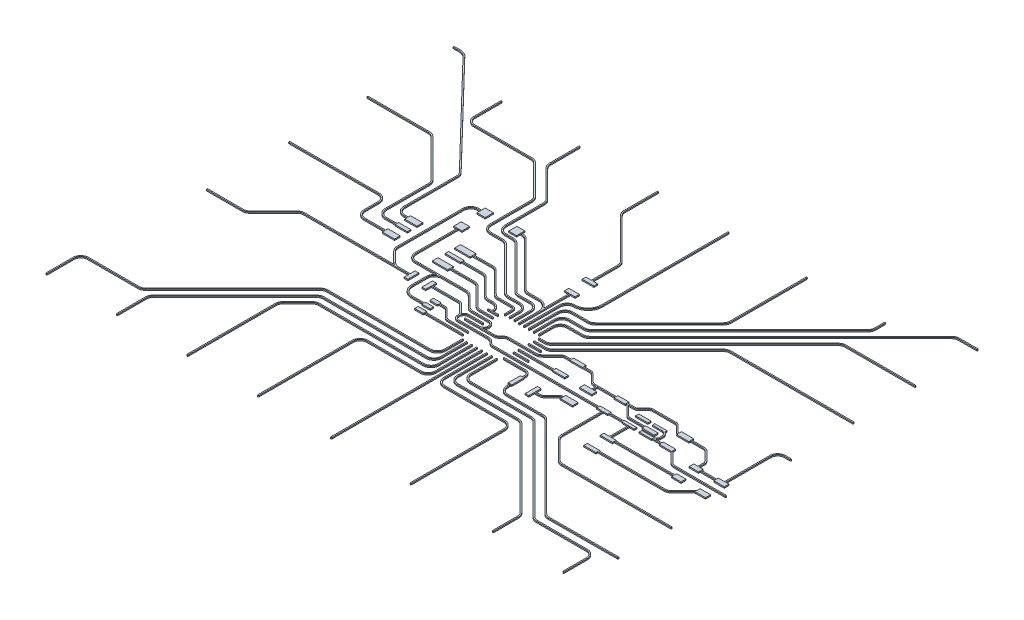
from build123d import *

# Parameters (mm, degrees)
BOSS_EXTRUDE1_DEPTH      = 0.2
BOSS_EXTRUDE2_DEPTH      = 0.01
BOSS_EXTRUDE2_DEPTH_BACK = 0.2
SKETCH5_W                = 2
SKETCH5_H                = 0.6
SKETCH5_H_2              = 0.801074898
SKETCH5_H_3              = 0.899691602
SKETCH5_W_2              = 0.6
SKETCH5_H_4              = 2
SKETCH5_H_5              = 0.63071227
SKETCH5_H_6              = 0.392724087
SKETCH5_H_7              = 0.44743684
SKETCH5_H_8              = 0.517672069
SKETCH5_H_9              = 0.795803545
SKETCH5_W_3              = 1.785055918
SKETCH5_H_10             = 0.617750025
SKETCH5_H_11             = 0.54655368
SKETCH5_H_12             = 0.660803526
SKETCH5_W_4              = 1.511774088
SKETCH5_H_13             = 0.749910678
SKETCH5_H_14             = 0.8
SKETCH5_W_5              = 1.702823586
SKETCH5_H_15             = 0.837747473
SKETCH5_W_6              = 1.25945291
SKETCH5_H_16             = 0.586172495
SKETCH5_W_7              = 1.315002125
SKETCH5_H_17             = 0.583888388
SKETCH5_W_8              = 1.380016589
SKETCH5_H_18             = 0.587615138
SKETCH5_W_9              = 0.603522402
SKETCH5_H_19             = 1.765265078
SKETCH5_W_10             = 0.63772589
SKETCH5_H_20             = 1.734095161
SKETCH5_W_11             = 1.900035091
SKETCH5_H_21             = 0.614152085
SKETCH5_W_12             = 1.726854463
SKETCH5_H_22             = 0.705413503
SKETCH5_W_13             = 2.503904973
SKETCH5_H_23             = 0.95039046
SKETCH5_H_24             = 0.571234979
SKETCH5_H_25             = 0.912283783
SKETCH5_W_14             = 1.994845849
SKETCH5_W_15             = 1.345745511
SKETCH5_H_26             = 1.337318337
SKETCH5_W_16             = 1.283826235
SKETCH5_H_27             = 1.227661167


# Read off the part's stored shape, not the designer's step: Boss-Extrude1
with BuildPart() as part:
    # Boss-Extrude1 outline → Boss-Extrude1 (new body)
    with BuildSketch(Plane(origin=(0, 10, 0), x_dir=(1, 0, 0), z_dir=(0, 1, 0))):
        with BuildLine():
            ThreePointArc((-7.271038605, -7.663864198), (-7.371009258, -7.763893536), (-7.27097992, -7.863864189))
            Line((-7.27097992, -7.863864189), (-0.45497992, -7.861864189))
            ThreePointArc((-0.45497992, -7.861864189), (-0.355009267, -7.761834851), (-0.455038605, -7.661864198))
            Line((-0.455038605, -7.661864198), (-7.271038605, -7.663864198))
        make_face()
        with BuildLine():
            Line((17.890290737, -5.558664194), (17.890290737, -4.255664194))
            Line((17.890290737, -4.255664194), (22.634495322, -4.255664194))
            Line((22.634495322, -4.255664194), (24.219983941, -5.840978753))
            ThreePointArc((24.219983941, -5.840978753), (24.511973795, -6.036062062), (24.856390737, -6.104564194))
            Line((24.856390737, -6.104564194), (28.491390737, -6.104564194))
            ThreePointArc((28.491390737, -6.104564194), (28.591390737, -6.004564194), (28.491390737, -5.904564194))
            Line((28.491390737, -5.904564194), (24.856390737, -5.904564194))
            ThreePointArc((24.856390737, -5.904564194), (24.58850541, -5.851284055), (24.361397534, -5.699549634))
            Line((24.361397534, -5.699549634), (22.917353562, -4.255664194))
            Line((22.917353562, -4.255664194), (23.811696874, -4.255664194))
            ThreePointArc((23.811696874, -4.255664194), (24.079598697, -4.20234617), (24.306706729, -4.050569558))
            Line((24.306706729, -4.050569558), (25.177001415, -3.180274872))
            ThreePointArc((25.177001415, -3.180274872), (25.339185941, -3.071915363), (25.530491226, -3.033864193))
            Line((25.530491226, -3.033864193), (29.233490737, -3.033864193))
            ThreePointArc((29.233490737, -3.033864193), (29.424797731, -3.071916273), (29.586983078, -3.18027789))
            Line((29.586983078, -3.18027789), (30.462284515, -4.055579327))
            ThreePointArc((30.462284515, -4.055579327), (30.689405563, -4.207301488), (30.95729858, -4.260564193))
            Line((30.95729858, -4.260564193), (35.056583559, -4.260564193))
            ThreePointArc((35.056583559, -4.260564193), (35.324478774, -4.313891335), (35.551577941, -4.465672754))
            Line((35.551577941, -4.465672754), (36.936982611, -5.850977423))
            ThreePointArc((36.936982611, -5.850977423), (37.0887122, -6.078082731), (37.141990737, -6.345963462))
            Line((37.141990737, -6.345963462), (37.141990737, -7.617564193))
            ThreePointArc((37.141990737, -7.617564193), (37.178100423, -7.694492913), (37.260351294, -7.715864194))
            Line((37.260351294, -7.715864194), (41.668790737, -7.715864194))
            Line((41.668790737, -7.715864194), (41.668790737, 0.080635806))
            ThreePointArc((41.668790737, 0.080635806), (41.990982234, 0.858445947), (42.768793053, 1.180635806))
            Line((42.768793053, 1.180635806), (43.657490737, 1.180635806))
            ThreePointArc((43.657490737, 1.180635806), (43.757490737, 1.280635806), (43.657490737, 1.380635806))
            Line((43.657490737, 1.380635806), (42.768788422, 1.380635806))
            ThreePointArc((42.768788422, 1.380635806), (41.849559241, 0.999865666), (41.468790737, 0.080635806))
            Line((41.468790737, 0.080635806), (41.468790737, -7.515864194))
            Line((41.468790737, -7.515864194), (37.341990738, -7.515864194))
            Line((37.341990738, -7.515864194), (37.341990738, -6.345964924))
            ThreePointArc((37.341990738, -6.345964924), (37.273487005, -6.001543386), (37.078398864, -5.709550964))
            Line((37.078398864, -5.709550964), (35.693003533, -4.324255634))
            ThreePointArc((35.693003533, -4.324255634), (35.40102486, -4.129119322), (35.056597916, -4.060564194))
            Line((35.056597916, -4.060564194), (30.957282894, -4.060564194))
            ThreePointArc((30.957282894, -4.060564194), (30.765929181, -4.02252017), (30.60369696, -3.91414906))
            Line((30.60369696, -3.91414906), (29.728398397, -3.038850497))
            ThreePointArc((29.728398397, -3.038850497), (29.501330474, -2.887138734), (29.233490738, -2.833864194))
            Line((29.233490738, -2.833864194), (25.530490248, -2.833864194))
            ThreePointArc((25.530490248, -2.833864194), (25.262648803, -2.887139644), (25.035580059, -3.038853516))
            Line((25.035580059, -3.038853516), (24.165274746, -3.909158829))
            ThreePointArc((24.165274746, -3.909158829), (24.003049399, -4.017575488), (23.811684601, -4.055664194))
            Line((23.811684601, -4.055664194), (17.276097949, -4.055660371))
            ThreePointArc((17.276097949, -4.055660371), (17.00820135, -4.002332656), (16.781101449, -3.850549693))
            Line((16.781101449, -3.850549693), (15.668308236, -2.73775648))
            ThreePointArc((15.668308236, -2.73775648), (15.376327944, -2.542616763), (15.03189795, -2.47406037))
            Line((15.03189795, -2.47406037), (10.985583593, -2.47406037))
            ThreePointArc((10.985583593, -2.47406037), (10.641158032, -2.542614926), (10.349180093, -2.737749692))
            Line((10.349180093, -2.737749692), (8.937281891, -4.149647894))
            ThreePointArc((8.937281891, -4.149647894), (8.580380277, -4.3881152), (8.159390771, -4.47186037))
            Line((8.159390771, -4.47186037), (7.244590771, -4.46386037))
            Line((7.244590771, -4.46386037), (3.805990737, -4.463864194))
            ThreePointArc((3.805990737, -4.463864194), (3.385049161, -4.547602796), (3.028188742, -4.786044833))
            Line((3.028188742, -4.786044833), (2.813888742, -5.000244833))
            ThreePointArc((2.813888742, -5.000244833), (2.521905337, -5.195345662), (2.1774872, -5.263864194))
            Line((2.1774872, -5.263864194), (0.32952187, -5.263864194))
            ThreePointArc((0.32952187, -5.263864194), (0.372451605, -5.226865441), (0.412970213, -5.187240799))
            ThreePointArc((0.412970213, -5.187240799), (0.591745853, -4.211047066), (-0.236206947, -3.663864193))
            Line((-0.236206947, -3.663864193), (-2.927409263, -3.663864193))
            ThreePointArc((-2.927409263, -3.663864193), (-3.34839877, -3.580119024), (-3.705300383, -3.341651717))
            Line((-3.705300383, -3.341651717), (-5.400298584, -1.646653515))
            ThreePointArc((-5.400298584, -1.646653515), (-5.822083221, -1.364833394), (-6.319607047, -1.265864194))
            Line((-6.319607047, -1.265864194), (-14.494109263, -1.265864194))
            ThreePointArc((-14.494109263, -1.265864194), (-15.271919403, -0.943672697), (-15.594109263, -0.165861878))
            Line((-15.594109263, -0.165861878), (-15.594109263, 7.296235806))
            ThreePointArc((-15.594109263, 7.296235806), (-15.694109263, 7.396235806), (-15.794109263, 7.296235806))
            Line((-15.794109263, 7.296235806), (-15.794109263, -0.165866509))
            ThreePointArc((-15.794109263, -0.165866509), (-15.413339122, -1.08509569), (-14.494109263, -1.465864194))
            Line((-14.494109263, -1.465864194), (-10.916538048, -1.465864194))
            ThreePointArc((-10.916538048, -1.465864194), (-11.384941112, -1.954973986), (-11.555509263, -2.610364194))
            Line((-11.555509263, -2.610364194), (-11.555509263, -4.973066509))
            ThreePointArc((-11.555509263, -4.973066509), (-11.057579122, -6.17513569), (-9.855509263, -6.673064194))
            Line((-9.855509263, -6.673064194), (-7.327209263, -6.673064194))
            ThreePointArc((-7.327209263, -6.673064194), (-7.227209263, -6.573064194), (-7.327209263, -6.473064194))
            Line((-7.327209263, -6.473064194), (-9.855509263, -6.473064194))
            ThreePointArc((-9.855509263, -6.473064194), (-10.916159403, -6.033712697), (-11.355509263, -4.973061878))
            Line((-11.355509263, -4.973061878), (-11.355509263, -2.610364194))
            ThreePointArc((-11.355509263, -2.610364194), (-11.020284535, -1.801088922), (-10.211009263, -1.465864194))
            Line((-10.211009263, -1.465864194), (-6.319611478, -1.465864194))
            ThreePointArc((-6.319611478, -1.465864194), (-5.898621954, -1.549608453), (-5.541719941, -1.788074872))
            Line((-5.541719941, -1.788074872), (-3.846718142, -3.48307667))
            ThreePointArc((-3.846718142, -3.48307667), (-3.424933106, -3.764895904), (-2.927409263, -3.863864194))
            Line((-2.927409263, -3.863864194), (-0.236211578, -3.863864194))
            ThreePointArc((-0.236211578, -3.863864194), (0.256651333, -4.066795091), (0.463765298, -4.557914836))
            ThreePointArc((0.463765298, -4.557914836), (0.283422603, -5.062163707), (-0.21266945, -5.263864194))
            Line((-0.21266945, -5.263864194), (-2.459009263, -5.263864194))
            ThreePointArc((-2.459009263, -5.263864194), (-2.559009263, -5.363864194), (-2.459009263, -5.463864194))
            Line((-2.459009263, -5.463864194), (2.177494274, -5.463864194))
            ThreePointArc((2.177494274, -5.463864194), (2.598433947, -5.380124915), (2.955292732, -5.141683555))
            Line((2.955292732, -5.141683555), (3.169592732, -4.927483555))
            ThreePointArc((3.169592732, -4.927483555), (3.461574503, -4.732383401), (3.805990737, -4.663864194))
            Line((3.805990737, -4.663864194), (7.244590737, -4.663864194))
            Line((7.244590737, -4.663864194), (8.159390737, -4.671864194))
            ThreePointArc((8.159390737, -4.671864194), (8.65691458, -4.572895903), (9.078699617, -4.29107667))
            Line((9.078699617, -4.29107667), (10.490601415, -2.879174872))
            ThreePointArc((10.490601415, -2.879174872), (10.717701316, -2.727391908), (10.985597916, -2.674064193))
            Line((10.985597916, -2.674064193), (15.031883558, -2.674064193))
            ThreePointArc((15.031883558, -2.674064193), (15.299775724, -2.727390071), (15.526873272, -2.879168084))
            Line((15.526873272, -2.879168084), (16.639680059, -3.991974871))
            ThreePointArc((16.639680059, -3.991974871), (16.931657558, -4.187111695), (17.276083559, -4.255668016))
            Line((17.276083559, -4.255668016), (17.690290737, -4.255668016))
            Line((17.690290737, -4.255668016), (17.690290737, -5.558664194))
            ThreePointArc((17.690290737, -5.558664194), (17.790290737, -5.658664194), (17.890290737, -5.558664194))
        make_face()
        with BuildLine():
            Line((21.839490737, -13.824261978), (21.839490737, -7.054664194))
            Line((21.839490737, -7.054664194), (25.787490737, -7.054664194))
            Line((25.787490737, -7.054664194), (25.787490737, -10.411064194))
            ThreePointArc((25.787490737, -10.411064194), (25.796006873, -10.451446151), (25.820104787, -10.484950144))
            ThreePointArc((25.820104787, -10.484950144), (25.85360878, -10.509048058), (25.893990737, -10.517564194))
            Line((25.893990737, -10.517564194), (37.241990737, -10.517564194))
            ThreePointArc((37.241990737, -10.517564194), (37.341990737, -10.417564194), (37.241990737, -10.317564194))
            Line((37.241990737, -10.317564194), (25.987490737, -10.317564194))
            Line((25.987490737, -10.317564194), (25.987490737, -6.981614333))
            ThreePointArc((25.987490737, -6.981614333), (25.97086198, -6.894228335), (25.891190737, -6.854664194))
            Line((25.891190737, -6.854664194), (21.740490737, -6.854664194))
            ThreePointArc((21.740490737, -6.854664194), (21.733781525, -6.854889515), (21.727102547, -6.855564464))
            Line((21.727102547, -6.855564464), (7.264490737, -6.855564464))
            ThreePointArc((7.264490737, -6.855564464), (7.264374507, -6.855564532), (7.264258278, -6.855564734))
            Line((7.264258278, -6.855564734), (3.693994274, -6.863864194))
            ThreePointArc((3.693994274, -6.863864194), (3.349576137, -6.795345663), (3.057592732, -6.600244833))
            Line((3.057592732, -6.600244833), (2.843292732, -6.386044833))
            ThreePointArc((2.843292732, -6.386044833), (2.486432313, -6.147602796), (2.065490737, -6.063864194))
            Line((2.065490737, -6.063864194), (-2.825706948, -6.063864194))
            ThreePointArc((-2.825706948, -6.063864194), (-3.206696136, -5.906046924), (-3.364509263, -5.52505602))
            ThreePointArc((-3.364509263, -5.52505602), (-3.367978889, -5.43990453), (-3.378350935, -5.355315906))
            ThreePointArc((-3.378350935, -5.355315906), (-3.165398748, -4.860910155), (-2.664441096, -4.663864194))
            Line((-2.664441096, -4.663864194), (-0.425875244, -4.660864149))
            ThreePointArc((-0.425875244, -4.660864149), (-0.326009307, -4.560730175), (-0.426143281, -4.460864238))
            Line((-0.426143281, -4.460864238), (-2.664577429, -4.463864193))
            ThreePointArc((-2.664577429, -4.463864193), (-3.165565924, -4.60701644), (-3.503275493, -5.003796335))
            ThreePointArc((-3.503275493, -5.003796335), (-3.580176579, -4.888084504), (-3.671698585, -4.783553516))
            Line((-3.671698585, -4.783553516), (-4.994592879, -3.460659222))
            ThreePointArc((-4.994592879, -3.460659222), (-5.10397059, -3.387552019), (-5.232998814, -3.361864194))
            Line((-5.232998814, -3.361864194), (-9.697001585, -3.361864194))
            ThreePointArc((-9.697001585, -3.361864194), (-9.938752679, -3.409929192), (-10.143711147, -3.546844722))
            ThreePointArc((-10.143711147, -3.546844722), (-10.143728734, -3.688266077), (-10.002307379, -3.688283665))
            ThreePointArc((-10.002307379, -3.688283665), (-9.862234576, -3.594712795), (-9.69701694, -3.561864193))
            Line((-9.69701694, -3.561864193), (-5.233019711, -3.561864193))
            ThreePointArc((-5.233019711, -3.561864193), (-5.180524385, -3.572320838), (-5.136025647, -3.602069165))
            Line((-5.136025647, -3.602069165), (-3.813119941, -4.924974871))
            ThreePointArc((-3.813119941, -4.924974871), (-3.629134592, -5.200299157), (-3.564509262, -5.525072367))
            ThreePointArc((-3.564509262, -5.525072367), (-3.348113349, -6.047472423), (-2.825711578, -6.263864193))
            Line((-2.825711578, -6.263864193), (2.065490737, -6.263864193))
            ThreePointArc((2.065490737, -6.263864193), (2.409906971, -6.332383401), (2.701888742, -6.527483554))
            Line((2.701888742, -6.527483554), (2.916188742, -6.741683554))
            ThreePointArc((2.916188742, -6.741683554), (3.273047527, -6.980124914), (3.6939872, -7.063864193))
            Line((3.6939872, -7.063864193), (7.264490737, -7.055564193))
            Line((7.264490737, -7.055564193), (21.639490737, -7.055563923))
            Line((21.639490737, -7.055563923), (21.639490737, -13.824266409))
            ThreePointArc((21.639490737, -13.824266409), (21.738459938, -14.321790235), (22.020280059, -14.743574872))
            Line((22.020280059, -14.743574872), (24.947281858, -17.67057667))
            ThreePointArc((24.947281858, -17.67057667), (25.369066894, -17.952395903), (25.866590737, -18.051364194))
            Line((25.866590737, -18.051364194), (43.540690737, -18.051364194))
            ThreePointArc((43.540690737, -18.051364194), (43.640690737, -17.951364194), (43.540690737, -17.851364194))
            Line((43.540690737, -17.851364194), (25.866590737, -17.851364194))
            ThreePointArc((25.866590737, -17.851364194), (25.44560123, -17.767619024), (25.088699617, -17.529151717))
            Line((25.088699617, -17.529151717), (22.161701415, -14.602153516))
            ThreePointArc((22.161701415, -14.602153516), (21.923234997, -14.245251502), (21.839490737, -13.824261978))
        make_face()
        with BuildLine():
            Line((35.204893563, -9.215864193), (43.522990737, -9.215864193))
            ThreePointArc((43.522990737, -9.215864193), (43.622990737, -9.115864194), (43.522990737, -9.015864194))
            Line((43.522990737, -9.015864194), (35.204887911, -9.015864194))
            ThreePointArc((35.204887911, -9.015864194), (34.900531985, -8.955337495), (34.642501415, -8.782953515))
            Line((34.642501415, -8.782953515), (32.720212094, -6.860664194))
            Line((32.720212094, -6.860664194), (29.898191267, -6.860664194))
            ThreePointArc((29.898191267, -6.860664194), (30.109027722, -6.5782544), (30.181990737, -6.233459243))
            Line((30.181990737, -6.233459243), (30.181990737, -5.933864193))
            ThreePointArc((30.181990737, -5.933864193), (29.895207275, -5.241424024), (29.202798739, -4.954564194))
            Line((29.202798739, -4.954564194), (28.491390737, -4.954564194))
            ThreePointArc((28.491390737, -4.954564194), (28.391390737, -5.054564194), (28.491390737, -5.154564194))
            Line((28.491390737, -5.154564194), (29.202782735, -5.154564194))
            ThreePointArc((29.202782735, -5.154564194), (29.75378026, -5.382839723), (29.981990737, -5.933864194))
            Line((29.981990737, -5.933864194), (29.981990737, -6.234298358))
            ThreePointArc((29.981990737, -6.234298358), (29.802172789, -6.676861758), (29.3612493, -6.860664194))
            Line((29.3612493, -6.860664194), (28.505790737, -6.860664194))
            ThreePointArc((28.505790737, -6.860664194), (28.405790737, -6.960664194), (28.505790737, -7.060664194))
            Line((28.505790737, -7.060664194), (32.637369381, -7.060664194))
            Line((32.637369381, -7.060664194), (34.501080059, -8.924374872))
            ThreePointArc((34.501080059, -8.924374872), (34.82399791, -9.140114482), (35.204893563, -9.215864193))
        make_face()
        with BuildLine():
            Line((-16.838302781, 11.006235806), (-15.694109263, 11.006235806))
            ThreePointArc((-15.694109263, 11.006235806), (-15.594109263, 11.106235806), (-15.694109263, 11.206235806))
            Line((-15.694109263, 11.206235806), (-16.838315745, 11.206235806))
            ThreePointArc((-16.838315745, 11.206235806), (-17.757492232, 10.825443483), (-18.138209263, 9.906235807))
            Line((-18.138209263, 9.906235807), (-18.138209263, -0.73775635))
            ThreePointArc((-18.138209263, -0.73775635), (-18.039292886, -1.235273472), (-17.757523265, -1.657071547))
            Line((-17.757523265, -1.657071547), (-16.19481827, -3.219676544))
            ThreePointArc((-16.19481827, -3.219676544), (-16.00481373, -3.383493897), (-15.792768909, -3.517564194))
            Line((-15.792768909, -3.517564194), (-30.305715645, -3.517564194))
            ThreePointArc((-30.305715645, -3.517564194), (-30.803187229, -3.616544137), (-31.224919941, -3.898353516))
            Line((-31.224919941, -3.898353516), (-35.012218142, -7.685651717))
            ThreePointArc((-35.012218142, -7.685651717), (-35.369119756, -7.924119024), (-35.790109263, -8.007864194))
            Line((-35.790109263, -8.007864194), (-41.549209263, -8.007864194))
            ThreePointArc((-41.549209263, -8.007864194), (-41.649209263, -8.107864194), (-41.549209263, -8.207864194))
            Line((-41.549209263, -8.207864194), (-35.790109263, -8.207864194))
            ThreePointArc((-35.790109263, -8.207864194), (-35.29258542, -8.108895903), (-34.870800383, -7.82707667))
            Line((-34.870800383, -7.82707667), (-31.083498585, -4.039774872))
            ThreePointArc((-31.083498585, -4.039774872), (-30.726644646, -3.801317601), (-30.30570288, -3.717564193))
            Line((-30.30570288, -3.717564193), (-12.873009263, -3.717564193))
            ThreePointArc((-12.873009263, -3.717564193), (-12.773009263, -3.617564193), (-12.873009263, -3.517564194))
            Line((-12.873009263, -3.517564194), (-14.992806868, -3.517564194))
            ThreePointArc((-14.992806868, -3.517564194), (-15.566793175, -3.403384031), (-16.053400256, -3.078251843))
            Line((-16.053400256, -3.078251843), (-17.61609526, -1.51565684))
            ThreePointArc((-17.61609526, -1.51565684), (-17.854512179, -1.158748375), (-17.938209263, -0.737772037))
            Line((-17.938209263, -0.737772037), (-17.938209263, 9.906235806))
            ThreePointArc((-17.938209263, 9.906235806), (-17.616066293, 10.68402671), (-16.838302781, 11.006235806))
        make_face()
        with BuildLine():
            Line((-3.606593062, -7.063864193), (-0.448977593, -7.062864191))
            ThreePointArc((-0.448977593, -7.062864191), (-0.349009265, -6.962832524), (-0.449040932, -6.862864196))
            Line((-0.449040932, -6.862864196), (-3.606625463, -6.863864194))
            ThreePointArc((-3.606625463, -6.863864194), (-3.874499538, -6.810582006), (-4.101598585, -6.658853516))
            Line((-4.101598585, -6.658853516), (-5.235502466, -5.524949634))
            ThreePointArc((-5.235502466, -5.524949634), (-5.52749232, -5.329866325), (-5.871909263, -5.261364194))
            Line((-5.871909263, -5.261364194), (-7.273509263, -5.261364194))
            ThreePointArc((-7.273509263, -5.261364194), (-7.373509263, -5.361364194), (-7.273509263, -5.461364194))
            Line((-7.273509263, -5.461364194), (-5.871909263, -5.461364194))
            ThreePointArc((-5.871909263, -5.461364194), (-5.604023935, -5.514644332), (-5.376916059, -5.666378753))
            Line((-5.376916059, -5.666378753), (-4.243019941, -6.800274872))
            ThreePointArc((-4.243019941, -6.800274872), (-3.951021257, -6.995364111), (-3.606593062, -7.063864193))
        make_face()
        with BuildLine():
            Line((-9.68721294, 11.206235806), (-10.614109263, 11.206235806))
            ThreePointArc((-10.614109263, 11.206235806), (-10.714109263, 11.106235806), (-10.614109263, 11.006235806))
            Line((-10.614109263, 11.006235806), (-9.687205585, 11.006235806))
            ThreePointArc((-9.687205585, 11.006235806), (-9.266279177, 10.922530474), (-8.909419941, 10.684125128))
            Line((-8.909419941, 10.684125128), (-1.823413976, 3.598119163))
            ThreePointArc((-1.823413976, 3.598119163), (-1.40167044, 3.316362913), (-0.904209263, 3.217435806))
            Line((-0.904209263, 3.217435806), (0.825785525, 3.217435806))
            ThreePointArc((0.825785525, 3.217435806), (1.975689345, 2.741078592), (2.451990737, 1.591151649))
            Line((2.451990737, 1.591151649), (2.450990742, -1.564832508))
            ThreePointArc((2.450990742, -1.564832508), (2.550959051, -1.664864189), (2.650990732, -1.564895879))
            Line((2.650990732, -1.564895879), (2.651990737, 1.591119964))
            Line((2.651990737, 1.591119964), (2.651990737, 6.933535806))
            ThreePointArc((2.651990737, 6.933535806), (2.551990737, 7.033535806), (2.451990737, 6.933535806))
            Line((2.451990737, 6.933535806), (2.451990737, 2.422118758))
            ThreePointArc((2.451990737, 2.422118758), (1.779087453, 3.148832869), (0.82579595, 3.417435807))
            Line((0.82579595, 3.417435807), (-0.904209262, 3.417435807))
            ThreePointArc((-0.904209262, 3.417435807), (-1.325141546, 3.501142049), (-1.68200455, 3.73955245))
            Line((-1.68200455, 3.73955245), (-8.767998584, 10.825546485))
            ThreePointArc((-8.767998584, 10.825546485), (-9.189745888, 11.107307788), (-9.68721294, 11.206235806))
        make_face()
        with BuildLine():
            Line((-27.065506947, 5.296135806), (-41.498009263, 5.296135806))
            ThreePointArc((-41.498009263, 5.296135806), (-41.598009263, 5.196135806), (-41.498009263, 5.096135806))
            Line((-41.498009263, 5.096135806), (-27.065511578, 5.096135806))
            ThreePointArc((-27.065511578, 5.096135806), (-26.287700759, 4.773945947), (-25.965509263, 3.996135806))
            Line((-25.965509263, 3.996135806), (-25.965509263, 1.723133491))
            ThreePointArc((-25.965509263, 1.723133491), (-25.584739122, 0.80390431), (-24.665509263, 0.423135806))
            Line((-24.665509263, 0.423135806), (-20.239709263, 0.423135806))
            ThreePointArc((-20.239709263, 0.423135806), (-20.139709263, 0.523135806), (-20.239709263, 0.623135806))
            Line((-20.239709263, 0.623135806), (-24.665509263, 0.623135806))
            ThreePointArc((-24.665509263, 0.623135806), (-25.443319403, 0.945327303), (-25.765509263, 1.723138122))
            Line((-25.765509263, 1.723138122), (-25.765509263, 3.996135806))
            ThreePointArc((-25.765509263, 3.996135806), (-26.146277766, 4.915365666), (-27.065506947, 5.296135806))
        make_face()
        with BuildLine():
            Line((-31.607607047, 17.996135806), (-41.498009263, 17.996135806))
            ThreePointArc((-41.498009263, 17.996135806), (-41.598009263, 17.896135806), (-41.498009263, 17.796135806))
            Line((-41.498009263, 17.796135806), (-31.607611478, 17.796135806))
            ThreePointArc((-31.607611478, 17.796135806), (-31.186621954, 17.712391547), (-30.829719941, 17.473925128))
            Line((-30.829719941, 17.473925128), (-24.748418793, 11.39262398))
            ThreePointArc((-24.748418793, 11.39262398), (-24.50996358, 11.035773388), (-24.426209263, 10.614835806))
            Line((-24.426209263, 10.614835806), (-24.426209263, 3.86157654))
            ThreePointArc((-24.426209263, 3.86157654), (-24.11128404, 2.790545807), (-23.131169752, 2.256073442))
            Line((-23.131169752, 2.256073442), (-20.267061723, 2.288942391))
            ThreePointArc((-20.267061723, 2.288942391), (-20.168215847, 2.390083346), (-20.269356802, 2.488929222))
            Line((-20.269356802, 2.488929222), (-23.12122237, 2.456200769))
            ThreePointArc((-23.12122237, 2.456200769), (-23.962381131, 2.924575622), (-24.226209262, 3.850490187))
            Line((-24.226209262, 3.850490187), (-24.226209262, 10.614835806))
            ThreePointArc((-24.226209262, 10.614835806), (-24.325188295, 11.112311575), (-24.606999733, 11.534047633))
            Line((-24.606999733, 11.534047633), (-30.688298584, 17.615346485))
            ThreePointArc((-30.688298584, 17.615346485), (-31.110083221, 17.897166606), (-31.607607047, 17.996135806))
        make_face()
        with BuildLine():
            Line((-41.000258574, 31.966135806), (-41.498009263, 31.966135806))
            ThreePointArc((-41.498009263, 31.966135806), (-41.598009263, 31.866135806), (-41.498009263, 31.766135806))
            Line((-41.498009263, 31.766135806), (-40.984759722, 31.766135806))
            ThreePointArc((-40.984759722, 31.766135806), (-40.264810422, 31.739162181), (-39.609905058, 31.438906398))
            Line((-39.609905058, 31.438906398), (-23.537354578, 14.766559283))
            ThreePointArc((-23.537354578, 14.766559283), (-23.298425696, 14.409438543), (-23.214509263, 13.988035806))
            Line((-23.214509263, 13.988035806), (-23.214509263, 5.401633491))
            ThreePointArc((-23.214509263, 5.401633491), (-22.833739122, 4.48240431), (-21.914509263, 4.101635806))
            Line((-21.914509263, 4.101635806), (-20.272509263, 4.101635806))
            ThreePointArc((-20.272509263, 4.101635806), (-20.172509263, 4.201635806), (-20.272509263, 4.301635806))
            Line((-20.272509263, 4.301635806), (-21.914509263, 4.301635806))
            ThreePointArc((-21.914509263, 4.301635806), (-22.692319403, 4.623827303), (-23.014509263, 5.401638122))
            Line((-23.014509263, 5.401638122), (-23.014509263, 13.988035806))
            ThreePointArc((-23.014509263, 13.988035806), (-23.113299146, 14.485128716), (-23.394637445, 14.906684838))
            Line((-23.394637445, 14.906684838), (-39.477957684, 31.590203618))
            ThreePointArc((-39.477957684, 31.590203618), (-40.201699351, 31.929652926), (-41.000258574, 31.966135806))
        make_face()
        with BuildLine():
            ThreePointArc((0.051990737, -1.472864194), (0.059875699, -1.511784878), (0.082287131, -1.5445678))
            ThreePointArc((0.082287131, -1.5445678), (0.191720098, -1.567473563), (0.253990428, -1.474615314))
            Line((0.253990428, -1.474615314), (0.251990737, -0.671139754))
            Line((0.251990737, -0.671139754), (0.251990737, -0.326664194))
            ThreePointArc((0.251990737, -0.326664194), (0.076252234, 0.097595666), (-0.348006947, 0.273335807))
            Line((-0.348006947, 0.273335807), (-2.607209263, 0.273335807))
            ThreePointArc((-2.607209263, 0.273335807), (-3.028146844, 0.357090124), (-3.384997436, 0.595545337))
            Line((-3.384997436, 0.595545337), (-6.710298584, 3.920846485))
            ThreePointArc((-6.710298584, 3.920846485), (-7.132261985, 4.202740636), (-7.62999402, 4.301635757))
            Line((-7.62999402, 4.301635757), (-11.965765803, 4.268832945))
            ThreePointArc((-11.965765803, 4.268832945), (-12.065006401, 4.168079266), (-11.964252722, 4.068838668))
            Line((-11.964252722, 4.068838668), (-7.629240345, 4.101635736))
            ThreePointArc((-7.629240345, 4.101635736), (-7.208450519, 4.01782052), (-6.851719941, 3.779425128))
            Line((-6.851719941, 3.779425128), (-3.526421089, 0.454126276))
            ThreePointArc((-3.526421089, 0.454126276), (-3.104685031, 0.172314839), (-2.607209263, 0.073335806))
            Line((-2.607209263, 0.073335806), (-0.348011578, 0.073335806))
            ThreePointArc((-0.348011578, 0.073335806), (-0.065170759, -0.043824053), (0.051990737, -0.326664194))
            Line((0.051990737, -0.326664194), (0.051990737, -1.472864194))
        make_face()
        with BuildLine():
            Line((-7.49331294, 2.527835806), (-11.965009263, 2.527835806))
            ThreePointArc((-11.965009263, 2.527835806), (-12.065009263, 2.427835806), (-11.965009263, 2.327835806))
            Line((-11.965009263, 2.327835806), (-7.493305585, 2.327835806))
            ThreePointArc((-7.493305585, 2.327835806), (-7.072379177, 2.244130474), (-6.715519941, 2.005725128))
            Line((-6.715519941, 2.005725128), (-4.148718143, -0.56107667))
            ThreePointArc((-4.148718143, -0.56107667), (-3.726933107, -0.842895904), (-3.229409263, -0.941864194))
            Line((-3.229409263, -0.941864194), (-2.540611578, -0.941864194))
            ThreePointArc((-2.540611578, -0.941864194), (-1.762799941, -1.264054872), (-1.440609263, -2.041866509))
            Line((-1.440609263, -2.041866509), (-1.440608545, -2.072864194))
            Line((-1.440608545, -2.072864194), (-1.876009263, -2.072864194))
            ThreePointArc((-1.876009263, -2.072864194), (-1.976009263, -2.172864194), (-1.876009263, -2.272864194))
            Line((-1.876009263, -2.272864194), (-0.382009263, -2.272864194))
            ThreePointArc((-0.382009263, -2.272864194), (-0.282009263, -2.172864194), (-0.382009263, -2.072864194))
            Line((-0.382009263, -2.072864194), (-1.240608545, -2.072864194))
            Line((-1.240608545, -2.072864194), (-1.240609263, -2.041861878))
            ThreePointArc((-1.240609263, -2.041861878), (-1.621378584, -1.122633515), (-2.540606947, -0.741864193))
            Line((-2.540606947, -0.741864193), (-3.229409262, -0.741864193))
            ThreePointArc((-3.229409262, -0.741864193), (-3.650398769, -0.658119023), (-4.007300383, -0.419651717))
            Line((-4.007300383, -0.419651717), (-6.574098584, 2.147146485))
            ThreePointArc((-6.574098584, 2.147146485), (-6.995845888, 2.428907788), (-7.49331294, 2.527835806))
        make_face()
        with BuildLine():
            Line((-6.93130288, 0.623135806), (-11.965009263, 0.623135806))
            ThreePointArc((-11.965009263, 0.623135806), (-12.065009263, 0.523135806), (-11.965009263, 0.423135806))
            Line((-11.965009263, 0.423135806), (-6.931315645, 0.423135806))
            ThreePointArc((-6.931315645, 0.423135806), (-6.510373879, 0.339382399), (-6.153519941, 0.100925128))
            Line((-6.153519941, 0.100925128), (-3.362715485, -2.689879327))
            ThreePointArc((-3.362715485, -2.689879327), (-2.940843433, -2.971678929), (-2.44324043, -3.070564193))
            Line((-2.44324043, -3.070564193), (-0.411679442, -3.063863921))
            ThreePointArc((-0.411679442, -3.063863921), (-0.312009535, -2.963534373), (-0.412339083, -2.863864466))
            Line((-0.412339083, -2.863864466), (-2.443578094, -2.870564195))
            ThreePointArc((-2.443578094, -2.870564195), (-2.864468552, -2.786836005), (-3.22130304, -2.54844906))
            Line((-3.22130304, -2.54844906), (-6.012098585, 0.242346485))
            ThreePointArc((-6.012098585, 0.242346485), (-6.433831296, 0.524155864), (-6.93130288, 0.623135806))
        make_face()
        with BuildLine():
            Line((-29.968009263, 23.741638122), (-29.968009263, 28.056135806))
            ThreePointArc((-29.968009263, 28.056135806), (-30.068009263, 28.156135806), (-30.168009263, 28.056135806))
            Line((-30.168009263, 28.056135806), (-30.168009263, 23.741633491))
            ThreePointArc((-30.168009263, 23.741633491), (-29.787239122, 22.82240431), (-28.868009263, 22.441635806))
            Line((-28.868009263, 22.441635806), (-19.616111478, 22.441635806))
            ThreePointArc((-19.616111478, 22.441635806), (-19.195121954, 22.357891547), (-18.838219941, 22.119425128))
            Line((-18.838219941, 22.119425128), (-14.071918793, 17.35312398))
            ThreePointArc((-14.071918793, 17.35312398), (-13.83346358, 16.996273388), (-13.749709263, 16.575335806))
            Line((-13.749709263, 16.575335806), (-13.749709263, 9.953937658))
            ThreePointArc((-13.749709263, 9.953937658), (-13.368961306, 9.034655783), (-12.449709263, 8.653835806))
            Line((-12.449709263, 8.653835806), (-10.544305586, 8.653835806))
            ThreePointArc((-10.544305586, 8.653835806), (-10.123379178, 8.570130474), (-9.766519941, 8.331725128))
            Line((-9.766519941, 8.331725128), (-2.936913976, 1.502119162))
            ThreePointArc((-2.936913976, 1.502119162), (-2.515170439, 1.220362913), (-2.017709263, 1.121435805))
            Line((-2.017709263, 1.121435805), (-0.248011579, 1.121435805))
            ThreePointArc((-0.248011579, 1.121435805), (0.52979924, 0.799245946), (0.851990737, 0.021435805))
            Line((0.851990737, 0.021435805), (0.851990737, -1.496864195))
            ThreePointArc((0.851990737, -1.496864195), (0.951990738, -1.596864194), (1.051990738, -1.496864194))
            Line((1.051990738, -1.496864194), (1.051990738, 0.021435806))
            ThreePointArc((1.051990738, 0.021435806), (0.671222235, 0.940665667), (-0.248006947, 1.321435807))
            Line((-0.248006947, 1.321435807), (-2.017709262, 1.321435807))
            ThreePointArc((-2.017709262, 1.321435807), (-2.438641545, 1.40514205), (-2.795504549, 1.64355245))
            Line((-2.795504549, 1.64355245), (-9.625098584, 8.473146485))
            ThreePointArc((-9.625098584, 8.473146485), (-10.046845888, 8.754907789), (-10.54431294, 8.853835807))
            Line((-10.54431294, 8.853835807), (-12.449709262, 8.853835807))
            ThreePointArc((-12.449709262, 8.853835807), (-13.22753864, 9.17607583), (-13.549709262, 9.953933955))
            Line((-13.549709262, 9.953933955), (-13.549709262, 16.575335806))
            ThreePointArc((-13.549709262, 16.575335806), (-13.648688295, 17.072811575), (-13.930499732, 17.494547633))
            Line((-13.930499732, 17.494547633), (-18.696798584, 22.260846485))
            ThreePointArc((-18.696798584, 22.260846485), (-19.118583221, 22.542666606), (-19.616107047, 22.641635806))
            Line((-19.616107047, 22.641635806), (-28.868009263, 22.641635806))
            ThreePointArc((-28.868009263, 22.641635806), (-29.645819403, 22.963827303), (-29.968009263, 23.741638122))
        make_face()
        with BuildLine():
            Line((-17.268009263, 23.285442189), (-17.268009263, 28.056135806))
            ThreePointArc((-17.268009263, 28.056135806), (-17.368009263, 28.156135806), (-17.468009263, 28.056135806))
            Line((-17.468009263, 28.056135806), (-17.468009263, 23.285429424))
            ThreePointArc((-17.468009263, 23.285429424), (-17.36902932, 22.78795784), (-17.087219941, 22.366225128))
            Line((-17.087219941, 22.366225128), (-12.696421739, 17.975426927))
            ThreePointArc((-12.696421739, 17.975426927), (-12.457954433, 17.618525313), (-12.374209263, 17.197535806))
            Line((-12.374209263, 17.197535806), (-12.374209263, 10.969133491))
            ThreePointArc((-12.374209263, 10.969133491), (-11.993439122, 10.04990431), (-11.074209263, 9.669135806))
            Line((-11.074209263, 9.669135806), (-9.856611478, 9.669135806))
            ThreePointArc((-9.856611478, 9.669135806), (-9.435621954, 9.585391547), (-9.078719941, 9.346925128))
            Line((-9.078719941, 9.346925128), (-2.249218143, 2.51742333))
            ThreePointArc((-2.249218143, 2.51742333), (-1.827433107, 2.235604096), (-1.329909263, 2.136635806))
            Line((-1.329909263, 2.136635806), (0.551988422, 2.136635806))
            ThreePointArc((0.551988422, 2.136635806), (1.329813414, 1.814431772), (1.651990737, 1.036595715))
            Line((1.651990737, 1.036595715), (1.653990752, -1.53194206))
            ThreePointArc((1.653990752, -1.53194206), (1.754068604, -1.631864179), (1.853990722, -1.531786327))
            Line((1.853990722, -1.531786327), (1.851990737, 1.036675897))
            ThreePointArc((1.851990737, 1.036675897), (1.471208061, 1.955879841), (0.551993053, 2.336635807))
            Line((0.551993053, 2.336635807), (-1.329909262, 2.336635807))
            ThreePointArc((-1.329909262, 2.336635807), (-1.750898769, 2.420380976), (-2.107800383, 2.658848283))
            Line((-2.107800383, 2.658848283), (-8.937298584, 9.488346485))
            ThreePointArc((-8.937298584, 9.488346485), (-9.359083221, 9.770166606), (-9.856607047, 9.869135806))
            Line((-9.856607047, 9.869135806), (-11.074209262, 9.869135806))
            ThreePointArc((-11.074209262, 9.869135806), (-11.852019403, 10.191327303), (-12.174209262, 10.969138122))
            Line((-12.174209262, 10.969138122), (-12.174209262, 17.197535806))
            ThreePointArc((-12.174209262, 17.197535806), (-12.273177553, 17.695059649), (-12.554996786, 18.116844686))
            Line((-12.554996786, 18.116844686), (-16.945798584, 22.507646485))
            ThreePointArc((-16.945798584, 22.507646485), (-17.184255855, 22.864500423), (-17.268009263, 23.285442189))
        make_face()
        with BuildLine():
            Line((-4.568009263, 22.670238022), (-4.568009263, 28.056135806))
            ThreePointArc((-4.568009263, 28.056135806), (-4.668009263, 28.156135806), (-4.768009263, 28.056135806))
            Line((-4.768009263, 28.056135806), (-4.768009263, 22.670233591))
            ThreePointArc((-4.768009263, 22.670233591), (-4.669040062, 22.172709765), (-4.387219941, 21.750925128))
            Line((-4.387219941, 21.750925128), (2.057181207, 15.30652398))
            ThreePointArc((2.057181207, 15.30652398), (2.29563642, 14.949673388), (2.379390737, 14.528735806))
            Line((2.379390737, 14.528735806), (2.379390737, 9.908835806))
            ThreePointArc((2.379390737, 9.908835806), (2.479390738, 9.808835806), (2.579390738, 9.908835806))
            Line((2.579390738, 9.908835806), (2.579390738, 14.528735806))
            ThreePointArc((2.579390738, 14.528735806), (2.480411705, 15.026211575), (2.198600268, 15.447947633))
            Line((2.198600268, 15.447947633), (-4.245798584, 21.892346485))
            ThreePointArc((-4.245798584, 21.892346485), (-4.484265003, 22.249248498), (-4.568009263, 22.670238022))
        make_face()
        with BuildLine():
            Line((6.861990671, 7.583433491), (6.861990671, 28.056135806))
            ThreePointArc((6.861990671, 28.056135806), (6.761990737, 28.15613574), (6.661990803, 28.056135806))
            Line((6.661990803, 28.056135806), (6.661990803, 7.583438122))
            ThreePointArc((6.661990803, 7.583438122), (6.03650067, 6.073422929), (4.526484231, 5.447935806))
            ThreePointArc((4.526484231, 5.447935806), (3.62529552, 5.074610497), (3.251990799, 4.173413257))
            Line((3.251990799, 4.173413257), (3.24299086, -1.56470735))
            ThreePointArc((3.24299086, -1.56470735), (3.342833893, -1.664864071), (3.442990614, -1.565021037))
            Line((3.442990614, -1.565021037), (3.451990676, 4.173258356))
            ThreePointArc((3.451990676, 4.173258356), (3.766666632, 4.933139017), (4.526497244, 5.247935807))
            ThreePointArc((4.526497244, 5.247935807), (6.177924905, 5.932004583), (6.861990671, 7.583433491))
        make_face()
        with BuildLine():
            Line((19.561990624, 15.736929424), (19.561990624, 28.056135806))
            ThreePointArc((19.561990624, 28.056135806), (19.461990737, 28.156135693), (19.361990851, 28.056135806))
            Line((19.361990851, 28.056135806), (19.361990851, 15.736942188))
            ThreePointArc((19.361990851, 15.736942188), (19.278237444, 15.316000422), (19.039780173, 14.959146484))
            Line((19.039780173, 14.959146484), (8.704479025, 4.623845336))
            ThreePointArc((8.704479025, 4.623845336), (8.347628433, 4.385390124), (7.926690851, 4.301635806))
            Line((7.926690851, 4.301635806), (5.351988536, 4.301635806))
            ThreePointArc((5.351988536, 4.301635806), (4.432798586, 3.920904896), (4.051990858, 3.001746769))
            Line((4.051990858, 3.001746769), (4.041990979, -1.551644583))
            ThreePointArc((4.041990979, -1.551644583), (4.141771127, -1.651863952), (4.241990496, -1.552083804))
            Line((4.241990496, -1.552083804), (4.251990617, 3.001524843))
            ThreePointArc((4.251990617, 3.001524843), (4.57414288, 3.779406715), (5.351992929, 4.101635806))
            Line((5.351992929, 4.101635806), (7.926690614, 4.101635806))
            ThreePointArc((7.926690614, 4.101635806), (8.424166382, 4.200614839), (8.84590244, 4.482426277))
            Line((8.84590244, 4.482426277), (19.181201292, 14.817725129))
            ThreePointArc((19.181201292, 14.817725129), (19.463010676, 15.239457839), (19.561990624, 15.736929424))
        make_face()
        with BuildLine():
            Line((32.261990736, 26.537429424), (32.261990736, 28.056135806))
            ThreePointArc((32.261990736, 28.056135806), (32.161990737, 28.156135805), (32.061990739, 28.056135806))
            Line((32.061990739, 28.056135806), (32.061990739, 26.537442189))
            ThreePointArc((32.061990739, 26.537442189), (31.978237289, 26.11650032), (31.739779903, 25.759646327))
            Line((31.739779903, 25.759646327), (9.326784438, 3.346550861))
            ThreePointArc((9.326784438, 3.346550861), (8.969871985, 3.108131674), (8.548890739, 3.024435806))
            Line((8.548890739, 3.024435806), (6.151988424, 3.024435806))
            ThreePointArc((6.151988424, 3.024435806), (5.232765002, 2.643671425), (4.85199074, 1.724452096))
            Line((4.85199074, 1.724452096), (4.850990742, -1.57983393))
            ThreePointArc((4.850990742, -1.57983393), (4.950960474, -1.679864189), (5.050990733, -1.579894457))
            Line((5.050990733, -1.579894457), (5.051990735, 1.724419517))
            ThreePointArc((5.051990735, 1.724419517), (5.374176473, 2.502240188), (6.151993051, 2.824435806))
            Line((6.151993051, 2.824435806), (8.548890735, 2.824435806))
            ThreePointArc((8.548890735, 2.824435806), (9.046402949, 2.923353399), (9.468197037, 3.205120752))
            Line((9.468197037, 3.205120752), (31.881201571, 25.618225286))
            ThreePointArc((31.881201571, 25.618225286), (32.163010835, 26.039957943), (32.261990736, 26.537429424))
        make_face()
        with BuildLine():
            Line((23.66679712, 11.446136074), (43.566490737, 11.446136074))
            ThreePointArc((43.566490737, 11.446136074), (43.666490469, 11.546135806), (43.566490737, 11.646135538))
            Line((43.566490737, 11.646135538), (23.666784355, 11.646135538))
            ThreePointArc((23.666784355, 11.646135538), (23.169312935, 11.547155654), (22.747580315, 11.265346449))
            Line((22.747580315, 11.265346449), (8.940478911, -2.541654955))
            ThreePointArc((8.940478911, -2.541654955), (8.583702458, -2.780079451), (8.162851238, -2.863864462))
            Line((8.162851238, -2.863864462), (6.330318121, -2.857864729))
            ThreePointArc((6.330318121, -2.857864729), (6.229991273, -2.95753681), (6.329663353, -3.057863658))
            Line((6.329663353, -3.057863658), (8.162530236, -3.063863926))
            ThreePointArc((8.162530236, -3.063863926), (8.660092363, -2.964915604), (9.081902563, -2.683073456))
            Line((9.081902563, -2.683073456), (22.889001159, 11.12392514))
            ThreePointArc((22.889001159, 11.12392514), (23.245855186, 11.362382598), (23.66679712, 11.446136074))
        make_face()
        with BuildLine():
            Line((32.156592953, 21.606113177), (43.402790737, 21.606113177))
            ThreePointArc((43.402790737, 21.606113177), (43.502807399, 21.707228426), (43.400605629, 21.806134565))
            Line((43.400605629, 21.806134565), (32.154403413, 21.806134565))
            ThreePointArc((32.154403413, 21.806134565), (31.656879877, 21.707166527), (31.23509495, 21.425347761))
            Line((31.23509495, 21.425347761), (8.068096749, -1.74165044))
            ThreePointArc((8.068096749, -1.74165044), (7.711169949, -1.980128917), (7.290150791, -2.063864176))
            Line((7.290150791, -2.063864176), (6.359990737, -2.063869033))
            ThreePointArc((6.359990737, -2.063869033), (6.259990737, -2.163869033), (6.359990737, -2.263869033))
            Line((6.359990737, -2.263869033), (7.290150791, -2.263864211))
            ThreePointArc((7.290150791, -2.263864211), (7.787701902, -2.164904984), (8.209510078, -1.883075428))
            Line((8.209510078, -1.883075428), (31.376511876, 21.28392637))
            ThreePointArc((31.376511876, 21.28392637), (31.734428045, 21.522799535), (32.156592953, 21.606113177))
        make_face()
        with BuildLine():
            Line((40.38429712, 31.766135807), (43.337290737, 31.766135807))
            ThreePointArc((43.337290737, 31.766135807), (43.437290737, 31.866135807), (43.337290737, 31.966135806))
            Line((43.337290737, 31.966135806), (40.384284355, 31.966135806))
            ThreePointArc((40.384284355, 31.966135806), (39.88681285, 31.867155896), (39.46508018, 31.585346605))
            Line((39.46508018, 31.585346605), (10.145478911, 2.265845336))
            ThreePointArc((10.145478911, 2.265845336), (9.788628319, 2.027390124), (9.367690737, 1.943635806))
            Line((9.367690737, 1.943635806), (6.951988422, 1.943635806))
            ThreePointArc((6.951988422, 1.943635806), (6.032759241, 1.562865666), (5.651990737, 0.643635806))
            Line((5.651990737, 0.643635806), (5.651990737, -1.584864194))
            ThreePointArc((5.651990737, -1.584864194), (5.751990737, -1.684864194), (5.851990737, -1.584864194))
            Line((5.851990737, -1.584864194), (5.851990737, 0.643635806))
            ThreePointArc((5.851990737, 0.643635806), (6.174182234, 1.421445947), (6.951993053, 1.743635806))
            Line((6.951993053, 1.743635806), (9.367690737, 1.743635806))
            ThreePointArc((9.367690737, 1.743635806), (9.865166505, 1.842614839), (10.286902563, 2.124426277))
            Line((10.286902563, 2.124426277), (39.606501295, 31.443925008))
            ThreePointArc((39.606501295, 31.443925008), (39.963355275, 31.682382367), (40.38429712, 31.766135807))
        make_face()
        with BuildLine():
            Line((6.297990737, -3.861864194), (8.148990737, -3.861864194))
            ThreePointArc((8.148990737, -3.861864194), (8.248990737, -3.761864194), (8.148990737, -3.661864194))
            Line((8.148990737, -3.661864194), (6.297990737, -3.661864194))
            ThreePointArc((6.297990737, -3.661864194), (6.197990737, -3.761864194), (6.297990737, -3.861864194))
        make_face()
        with BuildLine():
            Line((6.253990737, -6.248864194), (8.566990737, -6.248864194))
            ThreePointArc((8.566990737, -6.248864194), (8.666990737, -6.148864194), (8.566990737, -6.048864194))
            Line((8.566990737, -6.048864194), (6.253990737, -6.048864194))
            ThreePointArc((6.253990737, -6.048864194), (6.153990737, -6.148864194), (6.253990737, -6.248864194))
        make_face()
        with BuildLine():
            Line((6.273834072, -5.462864071), (13.486634072, -5.474164071))
            ThreePointArc((13.486634072, -5.474164071), (13.586790615, -5.374320859), (13.486947403, -5.274164316))
            Line((13.486947403, -5.274164316), (6.274147403, -5.262864316))
            ThreePointArc((6.274147403, -5.262864316), (6.17399086, -5.362707528), (6.273834072, -5.462864071))
        make_face()
        with BuildLine():
            Line((41.032090006, -10.715864193), (41.568790737, -10.715864193))
            ThreePointArc((41.568790737, -10.715864193), (41.668790737, -10.615864193), (41.568790737, -10.515864194))
            Line((41.568790737, -10.515864194), (41.032091468, -10.515864194))
            ThreePointArc((41.032091468, -10.515864194), (40.687671597, -10.584367236), (40.395680059, -10.779453516))
            Line((40.395680059, -10.779453516), (38.291583941, -12.883549634))
            ThreePointArc((38.291583941, -12.883549634), (38.064476065, -13.035284055), (37.796590737, -13.088564194))
            Line((37.796590737, -13.088564194), (25.909990737, -13.088564194))
            ThreePointArc((25.909990737, -13.088564194), (25.809990737, -13.188564194), (25.909990737, -13.288564194))
            Line((25.909990737, -13.288564194), (37.796590737, -13.288564194))
            ThreePointArc((37.796590737, -13.288564194), (38.14100768, -13.220062062), (38.432997534, -13.024978753))
            Line((38.432997534, -13.024978753), (40.537101415, -10.920874872))
            ThreePointArc((40.537101415, -10.920874872), (40.764207607, -10.769143421), (41.032090006, -10.715864193))
        make_face()
        with BuildLine():
            Line((32.307889842, -26.653864158), (43.436079338, -26.588362454))
            ThreePointArc((43.436079338, -26.588362454), (43.535488997, -26.487775594), (43.434902137, -26.388365934))
            Line((43.434902137, -26.388365934), (32.307303966, -26.453864157))
            ThreePointArc((32.307303966, -26.453864157), (31.886469938, -26.370064638), (31.529701415, -26.131653523))
            Line((31.529701415, -26.131653523), (18.310699617, -12.912651725))
            ThreePointArc((18.310699617, -12.912651725), (17.888914581, -12.630832491), (17.391390737, -12.531864201))
            Line((17.391390737, -12.531864201), (11.641993053, -12.531864201))
            ThreePointArc((11.641993053, -12.531864201), (10.864182234, -12.209674342), (10.541990737, -11.431864201))
            Line((10.541990737, -11.431864201), (10.541990737, -8.563861886))
            ThreePointArc((10.541990737, -8.563861886), (10.27839146, -7.927483568), (9.642021463, -7.663864202))
            Line((9.642021463, -7.663864202), (6.260049874, -7.661864211))
            ThreePointArc((6.260049874, -7.661864211), (6.159990755, -7.761805057), (6.259931601, -7.861864176))
            Line((6.259931601, -7.861864176), (9.641960011, -7.863864185))
            ThreePointArc((9.641960011, -7.863864185), (10.136950014, -8.068884818), (10.341990737, -8.5638665))
            Line((10.341990737, -8.5638665), (10.341990737, -11.431864185))
            ThreePointArc((10.341990737, -11.431864185), (10.722759241, -12.351094044), (11.641988422, -12.731864185))
            Line((11.641988422, -12.731864185), (17.391390737, -12.731864185))
            ThreePointArc((17.391390737, -12.731864185), (17.812380244, -12.815609355), (18.169281858, -13.054076661))
            Line((18.169281858, -13.054076661), (31.388280059, -26.273074863))
            ThreePointArc((31.388280059, -26.273074863), (31.810203891, -26.554952632), (32.307889842, -26.653864158))
        make_face()
        with BuildLine():
            Line((16.538597915, -8.518064193), (17.878990737, -8.518064193))
            ThreePointArc((17.878990737, -8.518064193), (17.978990737, -8.418064193), (17.878990737, -8.318064194))
            Line((17.878990737, -8.318064194), (16.538583559, -8.318064194))
            ThreePointArc((16.538583559, -8.318064194), (16.194157998, -8.386618749), (15.902180059, -8.581753516))
            Line((15.902180059, -8.581753516), (14.745083941, -9.738849634))
            ThreePointArc((14.745083941, -9.738849634), (14.517976065, -9.890584055), (14.250090737, -9.943864194))
            Line((14.250090737, -9.943864194), (13.241990737, -9.943864194))
            ThreePointArc((13.241990737, -9.943864194), (13.141990737, -10.043864194), (13.241990737, -10.143864194))
            Line((13.241990737, -10.143864194), (14.250090737, -10.143864194))
            ThreePointArc((14.250090737, -10.143864194), (14.59450768, -10.075362062), (14.886497534, -9.880278753))
            Line((14.886497534, -9.880278753), (16.043601415, -8.723174872))
            ThreePointArc((16.043601415, -8.723174872), (16.270701316, -8.571391908), (16.538597915, -8.518064193))
        make_face()
        with BuildLine():
            Line((40.951990759, -29.158866509), (40.951990759, -32.903864193))
            ThreePointArc((40.951990759, -32.903864193), (41.051990737, -33.003864172), (41.151990716, -32.903864194))
            Line((41.151990716, -32.903864194), (41.151990716, -29.158861878))
            ThreePointArc((41.151990716, -29.158861878), (40.771220575, -28.239632696), (39.851990714, -27.858864194))
            Line((39.851990714, -27.858864194), (31.780297096, -27.858864194))
            ThreePointArc((31.780297096, -27.858864194), (31.35935533, -27.775110787), (31.002501392, -27.536653516))
            Line((31.002501392, -27.536653516), (17.590199594, -14.124351717))
            ThreePointArc((17.590199594, -14.124351717), (17.168414557, -13.842532484), (16.670890714, -13.743564194))
            Line((16.670890714, -13.743564194), (6.951993029, -13.743564194))
            ThreePointArc((6.951993029, -13.743564194), (6.174164766, -13.421356889), (5.851990714, -12.643514851))
            Line((5.851990714, -12.643514851), (5.847990691, -8.492767824))
            ThreePointArc((5.847990691, -8.492767824), (5.747894368, -8.39286424), (5.647990784, -8.492960563))
            Line((5.647990784, -8.492960563), (5.651990761, -12.643613536))
            ThreePointArc((5.651990761, -12.643613536), (6.032776707, -13.562811498), (6.951988443, -13.943564194))
            Line((6.951988443, -13.943564194), (16.670890759, -13.943564194))
            ThreePointArc((16.670890759, -13.943564194), (17.091880266, -14.027309363), (17.448781879, -14.26577667))
            Line((17.448781879, -14.26577667), (30.861080081, -27.678074872))
            ThreePointArc((30.861080081, -27.678074872), (31.282812792, -27.959884251), (31.780284376, -28.058864193))
            Line((31.780284376, -28.058864193), (39.851990759, -28.058864193))
            ThreePointArc((39.851990759, -28.058864193), (40.629800899, -28.38105569), (40.951990759, -29.158866509))
        make_face()
        with BuildLine():
            Line((29.521990745, -28.890670576), (29.521990745, -32.903864193))
            ThreePointArc((29.521990745, -32.903864193), (29.621990736, -33.003864186), (29.721990729, -32.903864194))
            Line((29.721990729, -32.903864194), (29.721990729, -28.890657811))
            ThreePointArc((29.721990729, -28.890657811), (29.623010786, -28.393186227), (29.341201407, -27.971453516))
            Line((29.341201407, -27.971453516), (16.836902555, -15.467154664))
            ThreePointArc((16.836902555, -15.467154664), (16.415166497, -15.185343226), (15.917690729, -15.086364194))
            Line((15.917690729, -15.086364194), (6.151993044, -15.086364194))
            ThreePointArc((6.151993044, -15.086364194), (5.374191495, -14.764183603), (5.05199073, -13.986390411))
            Line((5.05199073, -13.986390411), (5.054990722, -8.506918943))
            ThreePointArc((5.054990722, -8.506918943), (4.955045486, -8.406864209), (4.854990752, -8.506809444))
            Line((4.854990752, -8.506809444), (4.851990745, -13.986337976))
            ThreePointArc((4.851990745, -13.986337976), (5.232749979, -14.905584784), (6.15198843, -15.286364194))
            Line((6.15198843, -15.286364194), (15.917690745, -15.286364194))
            ThreePointArc((15.917690745, -15.286364194), (16.338628327, -15.370118511), (16.695478919, -15.608573723))
            Line((16.695478919, -15.608573723), (29.199780067, -28.112874871))
            ThreePointArc((29.199780067, -28.112874871), (29.438237338, -28.46972881), (29.521990745, -28.890670576))
        make_face()
        with BuildLine():
            Line((16.141490787, -17.729066509), (16.141490787, -32.838364194))
            ThreePointArc((16.141490787, -32.838364194), (16.241490737, -32.938364144), (16.341490687, -32.838364194))
            Line((16.341490687, -32.838364194), (16.341490687, -17.729061878))
            ThreePointArc((16.341490687, -17.729061878), (15.960720545, -16.809832695), (15.041490683, -16.429064194))
            Line((15.041490683, -16.429064194), (5.351992998, -16.429064194))
            ThreePointArc((5.351992998, -16.429064194), (4.574155886, -16.106848039), (4.251990684, -15.328989821))
            Line((4.251990684, -15.328989821), (4.24199063, -8.499717764))
            ThreePointArc((4.24199063, -8.499717764), (4.141844308, -8.399864301), (4.041990845, -8.500010623))
            Line((4.041990845, -8.500010623), (4.051990791, -15.329138566))
            ThreePointArc((4.051990791, -15.329138566), (4.432785586, -16.248320347), (5.351988472, -16.629064194))
            Line((5.351988472, -16.629064194), (15.041490787, -16.629064194))
            ThreePointArc((15.041490787, -16.629064194), (15.819300928, -16.95125569), (16.141490787, -17.729066509))
        make_face()
        with BuildLine():
            Line((3.242990744, -8.519901142), (3.251990744, -32.878101142))
            ThreePointArc((3.251990744, -32.878101142), (3.352027686, -32.978064187), (3.451990731, -32.878027245))
            Line((3.451990731, -32.878027245), (3.442990731, -8.519827245))
            ThreePointArc((3.442990731, -8.519827245), (3.342953789, -8.4198642), (3.242990744, -8.519901142))
        make_face()
        with BuildLine():
            Line((-8.578009263, -17.593861878), (-8.578009263, -32.903864194))
            ThreePointArc((-8.578009263, -32.903864194), (-8.478009263, -33.003864194), (-8.378009263, -32.903864194))
            Line((-8.378009263, -32.903864194), (-8.378009263, -17.593866509))
            ThreePointArc((-8.378009263, -17.593866509), (-8.055819403, -16.81605569), (-7.278009263, -16.493864194))
            Line((-7.278009263, -16.493864194), (1.351993053, -16.493864194))
            ThreePointArc((1.351993053, -16.493864194), (2.271224479, -16.113091808), (2.651990738, -15.193857844))
            Line((2.651990738, -15.193857844), (2.650990737, -8.533849179))
            ThreePointArc((2.650990737, -8.533849179), (2.550975722, -8.433864194), (2.450990738, -8.533879209))
            Line((2.450990738, -8.533879209), (2.451990737, -15.193870543))
            ThreePointArc((2.451990737, -15.193870543), (2.129796996, -15.971676579), (1.351988422, -16.293864194))
            Line((1.351988422, -16.293864194), (-7.278009263, -16.293864194))
            ThreePointArc((-7.278009263, -16.293864194), (-8.197239122, -16.674632697), (-8.578009263, -17.593861878))
        make_face()
        with BuildLine():
            Line((-20.008009263, -18.666657811), (-20.008009263, -32.903864194))
            ThreePointArc((-20.008009263, -32.903864194), (-19.908009263, -33.003864194), (-19.808009263, -32.903864194))
            Line((-19.808009263, -32.903864194), (-19.808009263, -18.666670576))
            ThreePointArc((-19.808009263, -18.666670576), (-19.724255855, -18.24572881), (-19.485798584, -17.888874872))
            Line((-19.485798584, -17.888874872), (-17.142997436, -15.546073724))
            ThreePointArc((-17.142997436, -15.546073724), (-16.786146844, -15.307618511), (-16.365209262, -15.223864194))
            Line((-16.365209262, -15.223864194), (0.551993053, -15.223864194))
            ThreePointArc((0.551993053, -15.223864194), (1.471215258, -14.843101029), (1.851990737, -13.923883925))
            Line((1.851990737, -13.923883925), (1.853990734, -8.539901341))
            ThreePointArc((1.853990734, -8.539901341), (1.754027885, -8.439864197), (1.653990741, -8.539827046))
            Line((1.653990741, -8.539827046), (1.651990737, -13.923844462))
            ThreePointArc((1.651990737, -13.923844462), (1.329806216, -14.701667358), (0.551988422, -15.023864193))
            Line((0.551988422, -15.023864193), (-16.365209263, -15.023864193))
            ThreePointArc((-16.365209263, -15.023864193), (-16.862685031, -15.122843226), (-17.284421089, -15.404654663))
            Line((-17.284421089, -15.404654663), (-19.627219941, -17.747453515))
            ThreePointArc((-19.627219941, -17.747453515), (-19.90902932, -18.169186227), (-20.008009263, -18.666657811))
        make_face()
        with BuildLine():
            Line((-31.438009263, -28.262740783), (-31.438009263, -32.903864194))
            ThreePointArc((-31.438009263, -32.903864194), (-31.338009263, -33.003864194), (-31.238009263, -32.903864194))
            Line((-31.238009263, -32.903864194), (-31.238009263, -28.262740783))
            ThreePointArc((-31.238009263, -28.262740783), (-31.154273016, -27.841770241), (-30.915812359, -27.484888648))
            Line((-30.915812359, -27.484888648), (-17.706984806, -14.276061095))
            ThreePointArc((-17.706984806, -14.276061095), (-17.350103212, -14.037600438), (-16.929132669, -13.953864191))
            Line((-16.929132669, -13.953864191), (-0.248037044, -13.953863918))
            ThreePointArc((-0.248037044, -13.953863918), (0.670772699, -13.573542983), (1.051989848, -12.65510472))
            Line((1.051989848, -12.65510472), (1.05599069, -8.553961748))
            ThreePointArc((1.05599069, -8.553961748), (0.956088292, -8.453864241), (0.855990785, -8.553766639))
            Line((0.855990785, -8.553766639), (0.851989943, -12.654909611))
            ThreePointArc((0.851989943, -12.654909611), (0.529420341, -13.432052662), (-0.248037044, -13.753863918))
            Line((-0.248037044, -13.753863918), (-16.929132672, -13.753864191))
            ThreePointArc((-16.929132672, -13.753864191), (-17.4266399, -13.852824532), (-17.848406162, -14.134639739))
            Line((-17.848406162, -14.134639739), (-31.057233715, -27.343467292))
            ThreePointArc((-31.057233715, -27.343467292), (-31.339048922, -27.765233555), (-31.438009263, -28.262740783))
        make_face()
        with BuildLine():
            Line((-42.868009263, -28.602141977), (-42.868009263, -32.903864194))
            ThreePointArc((-42.868009263, -32.903864194), (-42.768009263, -33.003864194), (-42.668009263, -32.903864194))
            Line((-42.668009263, -32.903864194), (-42.668009263, -28.602141977))
            ThreePointArc((-42.668009263, -28.602141977), (-42.345803939, -27.824269515), (-41.567931476, -27.502064191))
            Line((-41.567931476, -27.502064191), (-33.436515133, -27.502064191))
            ThreePointArc((-33.436515133, -27.502064191), (-32.91984667, -27.399292444), (-32.481836296, -27.106623269))
            Line((-32.481836296, -27.106623269), (-18.366629465, -12.991416438))
            ThreePointArc((-18.366629465, -12.991416438), (-18.009747872, -12.752955781), (-17.58877733, -12.669219534))
            Line((-17.58877733, -12.669219534), (-1.012681704, -12.669219534))
            ThreePointArc((-1.012681704, -12.669219534), (-0.059256411, -12.27499183), (0.337340088, -11.322549449))
            Line((0.337340088, -11.322549449), (0.344347434, -8.503594227))
            ThreePointArc((0.344347434, -8.503594227), (0.244596322, -8.403345957), (0.144348052, -8.503097069))
            Line((0.144348052, -8.503097069), (0.137340706, -11.322052292))
            ThreePointArc((0.137340706, -11.322052292), (-0.200501886, -12.133394811), (-1.012681704, -12.469219534))
            Line((-1.012681704, -12.469219534), (-17.58877733, -12.469219534))
            ThreePointArc((-17.58877733, -12.469219534), (-18.086284558, -12.568179875), (-18.508050821, -12.849995082))
            Line((-18.508050821, -12.849995082), (-32.623257653, -26.965201913))
            ThreePointArc((-32.623257653, -26.965201913), (-32.996383356, -27.214516537), (-33.436515133, -27.302064191))
            Line((-33.436515133, -27.302064191), (-41.567931476, -27.302064191))
            ThreePointArc((-41.567931476, -27.302064191), (-42.487225295, -27.682848159), (-42.868009263, -28.602141977))
        make_face()
    extrude(amount=BOSS_EXTRUDE1_DEPTH)

    # Sketch5 → Boss-Extrude2 (add, two sides: drawn at the far end of the back side and taken through both)
    with BuildSketch(Plane(origin=(0, 10.2, 0), x_dir=(1, 0, 0), z_dir=(0, 1, 0)).offset(-BOSS_EXTRUDE2_DEPTH_BACK)):
        with Locations((12.89842125, -5.288133161)):
            Rectangle(SKETCH5_W, SKETCH5_H)
        with Locations((12.89842125, -2.429152006)):
            Rectangle(SKETCH5_W, SKETCH5_H)
        with Locations((17.489403687, -5.38867061)):
            Rectangle(SKETCH5_W, SKETCH5_H_2)
        with Locations((17.489403687, -8.452140475)):
            Rectangle(SKETCH5_W, SKETCH5_H_3)
        with Locations((10.345070602, -9.901986276)):
            Rectangle(SKETCH5_W_2, SKETCH5_H_4)
        with Locations((13.241990737, -10.043864194)):
            Rectangle(SKETCH5_W_2, SKETCH5_H_4)
        with Locations((25.893990737, -10.517564194)):
            Rectangle(SKETCH5_W, SKETCH5_H)
        with Locations((25.987490737, -13.288564194)):
            Rectangle(SKETCH5_W, SKETCH5_H)
        with Locations((28.261888625, -6.104564194)):
            Rectangle(SKETCH5_W, SKETCH5_H_5)
        with Locations((28.680730678, -4.954564194)):
            Rectangle(SKETCH5_W, SKETCH5_H_6)
        with Locations((28.5899319, -6.975592889)):
            Rectangle(SKETCH5_W, SKETCH5_H_7)
        with Locations((25.765840481, -6.975592889)):
            Rectangle(SKETCH5_W, SKETCH5_H_7)
        with Locations((26.022140993, -4.954564194)):
            Rectangle(SKETCH5_W, SKETCH5_H_8)
        with Locations((31.965949997, -4.123259392)):
            Rectangle(SKETCH5_W, SKETCH5_H_9)
        with Locations((21.6471265, -4.123259392)):
            Rectangle(SKETCH5_W_3, SKETCH5_H_10)
        with Locations((21.6471265, -6.975592889)):
            Rectangle(SKETCH5_W_3, SKETCH5_H_11)
        with Locations((31.965949997, -6.975592889)):
            Rectangle(SKETCH5_W, SKETCH5_H_12)
        with Locations((37.241990737, -7.617564194)):
            Rectangle(SKETCH5_W_4, SKETCH5_H_13)
        with Locations((37.241990737, -10.417564194)):
            Rectangle(SKETCH5_W_4, SKETCH5_H_14)
        with Locations((41.335461339, -7.617564194)):
            Rectangle(SKETCH5_W_5, SKETCH5_H_13)
        with Locations((41.335461339, -10.624990458)):
            Rectangle(SKETCH5_W_5, SKETCH5_H_15)
        with Locations((-7.260431192, -5.38867061)):
            Rectangle(SKETCH5_W_6, SKETCH5_H_16)
        with Locations((-7.318706501, -6.577356971)):
            Rectangle(SKETCH5_W_7, SKETCH5_H_17)
        with Locations((-7.271009263, -7.763864194)):
            Rectangle(SKETCH5_W_8, SKETCH5_H_18)
        with Locations((-12.915200548, -3.611784545)):
            Rectangle(SKETCH5_W_9, SKETCH5_H_19)
        with Locations((-10.077379695, -3.596199587)):
            Rectangle(SKETCH5_W_10, SKETCH5_H_20)
        with Locations((2.465400424, 9.94719928)):
            Rectangle(SKETCH5_W_11, SKETCH5_H_21)
        with Locations((2.551990738, 6.933535807)):
            Rectangle(SKETCH5_W_12, SKETCH5_H_22)
        with Locations((-11.965009263, 4.168835806)):
            Rectangle(SKETCH5_W_13, SKETCH5_H_23)
        with Locations((-11.965009263, 2.427835807)):
            Rectangle(SKETCH5_W_13, SKETCH5_H_24)
        with Locations((-11.965009263, 0.523135807)):
            Rectangle(SKETCH5_W_13, SKETCH5_H_25)
        with Locations((-20.344265727, 4.168835806)):
            Rectangle(SKETCH5_W_14, SKETCH5_H_23)
        with Locations((-20.344265727, 2.427835807)):
            Rectangle(SKETCH5_W_14, SKETCH5_H_24)
        with Locations((-20.344265727, 0.523135807)):
            Rectangle(SKETCH5_W_14, SKETCH5_H_25)
        with Locations((-15.694109263, 11.106235807)):
            Rectangle(SKETCH5_W_15, SKETCH5_H_26)
        with Locations((-10.573060103, 11.106235807)):
            Rectangle(SKETCH5_W_16, SKETCH5_H_26)
        with Locations((-15.694109263, 7.286242558)):
            Rectangle(SKETCH5_W_15, SKETCH5_H_27)
    extrude(amount=BOSS_EXTRUDE2_DEPTH + BOSS_EXTRUDE2_DEPTH_BACK)


solid = part.part
